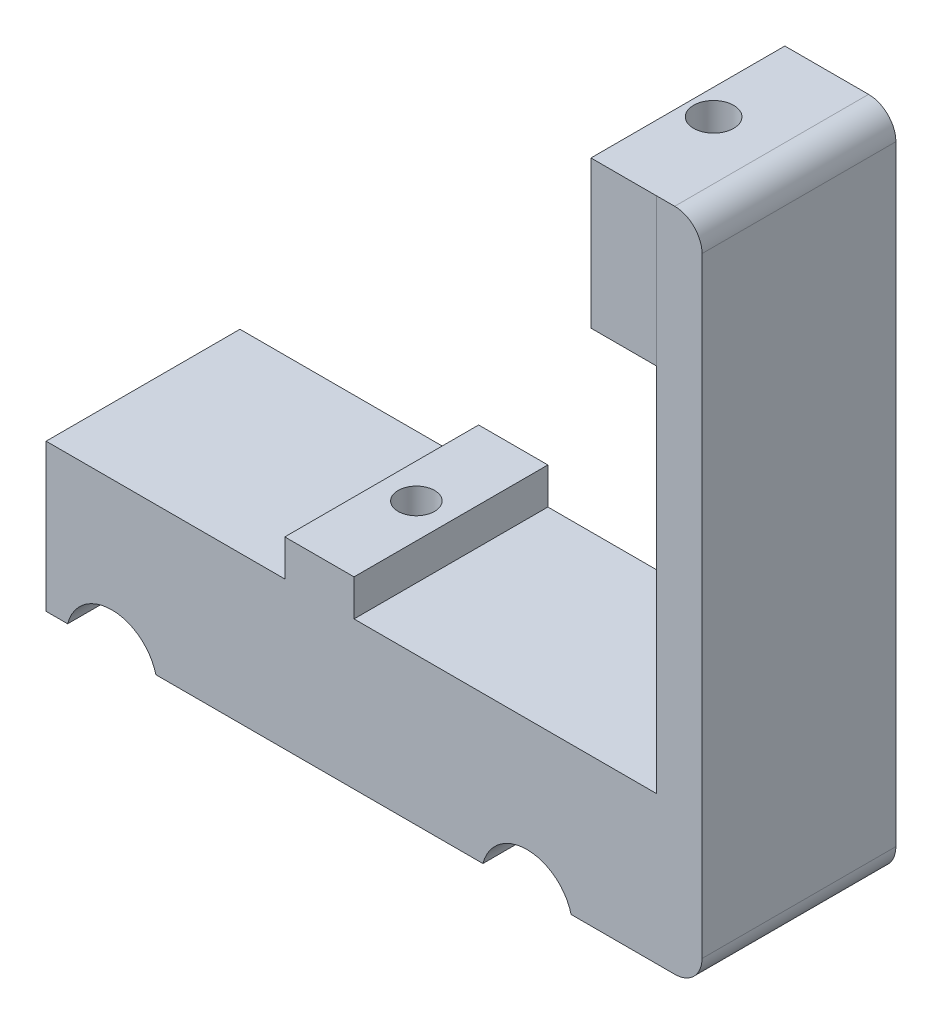
from build123d import *

# Parameters (mm, degrees)
BOSS_EXTRUDE1_DEPTH     = 10.8
BOSS_EXTRUDE2_DEPTH     = 10.64
CUT_EXTRUDE1_DEPTH      = 39.168054705
CUT_EXTRUDE1_DEPTH_BACK = 39.168054705
SKETCH5_R               = 5
FILLET1_R               = 1
SKETCH6_W               = 21.28
SKETCH6_H               = 16.18
BOSS_EXTRUDE3_DEPTH     = 12
SKETCH7_W               = 5
SKETCH7_H               = 21.281328743
BOSS_EXTRUDE4_DEPTH     = 56.83
SKETCH8_W               = 21.284331222
SKETCH8_H               = 16.18
BOSS_EXTRUDE5_DEPTH     = 7.19
FILLET3_R               = 3
SKETCH9_R               = 2.2
CUT_EXTRUDE2_DEPTH      = 85.918196519
SKETCH10_R              = 2
CUT_EXTRUDE3_DEPTH      = 85.918196519
SKETCH11_W              = 24.977296572
SKETCH11_H              = 9.721484234
CUT_EXTRUDE4_DEPTH      = 71.220021919


with BuildPart() as part:
    # Sketch2 → Boss-Extrude1 (new body)
    with BuildSketch(Plane.XY):
        Polygon((10.1, 0), (10.1, 1.709943763), (6.25480432, 7), (-6.25480432, 7), (-10.1, 1.709943763), (-10.1, 0), align=None)
    extrude(amount=BOSS_EXTRUDE1_DEPTH)

    # Sketch4 → Boss-Extrude2 (add, symmetric)
    with BuildSketch(Plane.XY):
        Polygon((-3.8, 0), (-3.8, -4.8), (-30, -4.8), (-30, -20.98), (30, -20.98), (30, -4.8), (3.8, -4.8), (3.8, 0), align=None)
    extrude(amount=BOSS_EXTRUDE2_DEPTH, both=True)

    # Sketch5 → Cut-Extrude1 (cut, two sides: drawn at the far end of the back side and taken through both)
    with BuildSketch(Plane.XY.offset(-CUT_EXTRUDE1_DEPTH_BACK)):
        with Locations((-22.790976064, -22.227391232)):
            Circle(SKETCH5_R)
        with Locations((22.790976064, -22.227391232)):
            Circle(SKETCH5_R)
    extrude(amount=CUT_EXTRUDE1_DEPTH + CUT_EXTRUDE1_DEPTH_BACK, mode=Mode.SUBTRACT)

    # Fillet1
    fillet1_edges = [part.edges().sort_by_distance(p)[0] for p in [
        (-10.1, 0, 5.4),
        (-10.1, 1.709943763, 5.4),
        (-6.25480432, 7, 5.4),
        (6.25480432, 7, 5.4),
        (10.1, 0, 5.4),
        (10.1, 1.709943763, 5.4),
    ]]
    fillet(fillet1_edges, radius=FILLET1_R)

    # Sketch6 → Boss-Extrude3 (add)
    with BuildSketch(Plane(origin=(30, 0, 0), x_dir=(0, 0, -1), z_dir=(1, 0, 0))):
        with Locations((0, -12.89)):
            Rectangle(SKETCH6_W, SKETCH6_H)
    extrude(amount=BOSS_EXTRUDE3_DEPTH)

    # Sketch7 → Boss-Extrude4 (add)
    with BuildSketch(Plane(origin=(0, -4.8, 0), x_dir=(1, 0, 0), z_dir=(0, 1, 0))):
        with Locations((39.5, 0.000664372)):
            Rectangle(SKETCH7_W, SKETCH7_H)
    extrude(amount=BOSS_EXTRUDE4_DEPTH)

    # Sketch8 → Boss-Extrude5 (add)
    with BuildSketch(Plane.ZY.offset(-37)):
        with Locations((0.000836868, 43.94)):
            Rectangle(SKETCH8_W, SKETCH8_H)
    extrude(amount=BOSS_EXTRUDE5_DEPTH)

    # Fillet3
    fillet3_edges = [part.edges().sort_by_distance(p)[0] for p in [
        (42, 52.03, -0.000664372),
        (42, -20.98, 0),
    ]]
    fillet(fillet3_edges, radius=FILLET3_R)

    # Sketch9 → Cut-Extrude2 (cut, through all)
    with BuildSketch(Plane.XZ.offset(20.98)):
        with Locations((32.632878078, 0)):
            Circle(SKETCH9_R)
    extrude(amount=-CUT_EXTRUDE2_DEPTH, mode=Mode.SUBTRACT)

    # Sketch10 → Cut-Extrude3 (cut, through all)
    with BuildSketch(Plane.XZ.offset(20.98)):
        with Locations((0.000925951, 0)):
            Circle(SKETCH10_R)
    extrude(amount=-CUT_EXTRUDE3_DEPTH, mode=Mode.SUBTRACT)

    # Sketch11 → Cut-Extrude4 (cut, through all)
    with BuildSketch(Plane.XY.offset(10.8)):
        with Locations((-0.121132817, 4.060742117)):
            Rectangle(SKETCH11_W, SKETCH11_H)
    extrude(amount=-CUT_EXTRUDE4_DEPTH, mode=Mode.SUBTRACT)


solid = part.part
